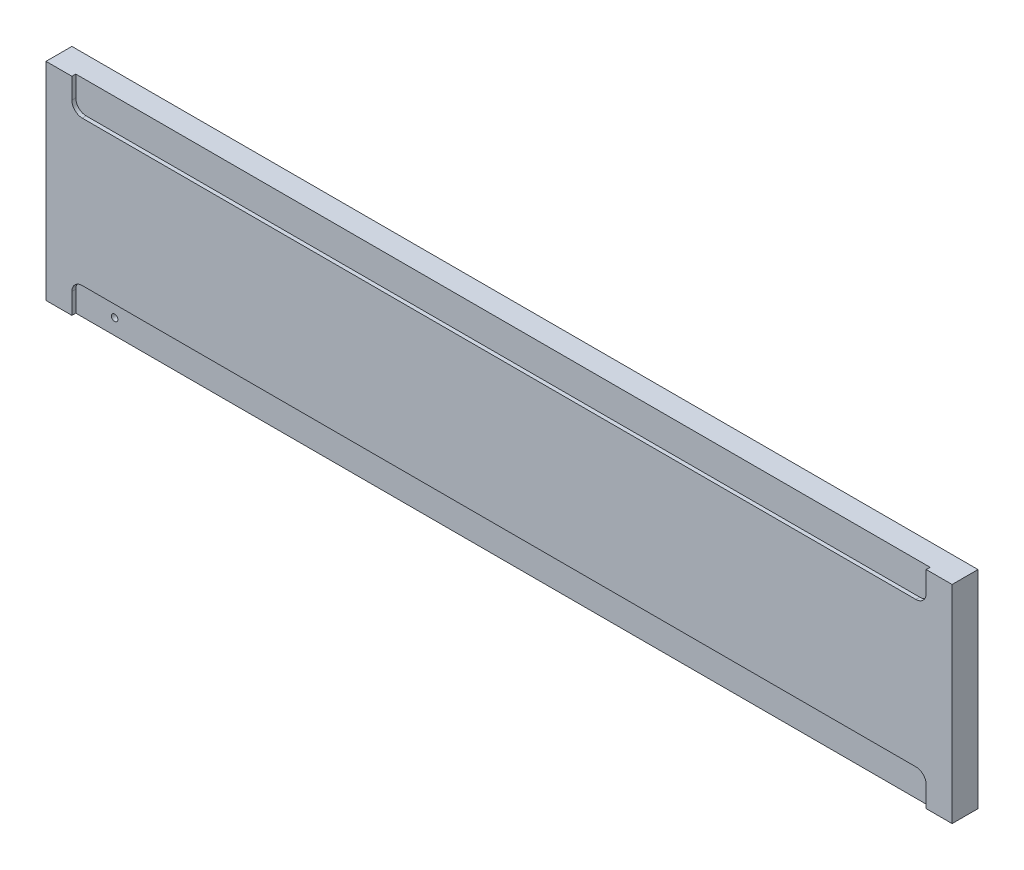
from build123d import *

# Parameters (mm, degrees)
CROQUIS1_W                = 350
CROQUIS1_H                = 80
SALIENTE_EXTRUIR1_DEPTH   = 10
CORTAR_EXTRUIR1_DEPTH     = 1.5
TALADRO_ROSCADO_M31_D     = 2.5
TALADRO_ROSCADO_M31_DEPTH = 7
TALADRO_ROSCADO_M31_TIP   = 0.751075774


with BuildPart() as part:
    # Croquis1 → Saliente-Extruir1 (new body)
    with BuildSketch(Plane.XY):
        with Locations((175, 40)):
            Rectangle(CROQUIS1_W, CROQUIS1_H)
    extrude(amount=SALIENTE_EXTRUIR1_DEPTH)

    # Croquis2 → Cortar-Extruir1 (cut)
    with BuildSketch(Plane.XY.offset(10)):
        with BuildLine():
            Line((10, 80), (340, 80))
            Line((340, 80), (340, 72))
            ThreePointArc((340, 72), (338.828427125, 69.171572875), (336, 68))
            Line((336, 68), (14, 68))
            ThreePointArc((14, 68), (11.171572875, 69.171572875), (10, 72))
            Line((10, 72), (10, 80))
        make_face()
        with BuildLine():
            Line((10, 0), (340, 0))
            Line((340, 0), (340, 8))
            ThreePointArc((340, 8), (338.828427125, 10.828427125), (336, 12))
            Line((336, 12), (14, 12))
            ThreePointArc((14, 12), (11.171572875, 10.828427125), (10, 8))
            Line((10, 8), (10, 0))
        make_face()
    extrude(amount=-CORTAR_EXTRUIR1_DEPTH, mode=Mode.SUBTRACT)

    # Taladro roscado M31
    with Locations(Plane.XY.offset(8.5)):
        with Locations((25, 6)):
            Hole(TALADRO_ROSCADO_M31_D / 2, depth=TALADRO_ROSCADO_M31_DEPTH)
            with Locations((0, 0, -(TALADRO_ROSCADO_M31_DEPTH + TALADRO_ROSCADO_M31_TIP / 2))):  # 118° drill point
                Cone(0, TALADRO_ROSCADO_M31_D / 2, TALADRO_ROSCADO_M31_TIP, mode=Mode.SUBTRACT)


solid = part.part
